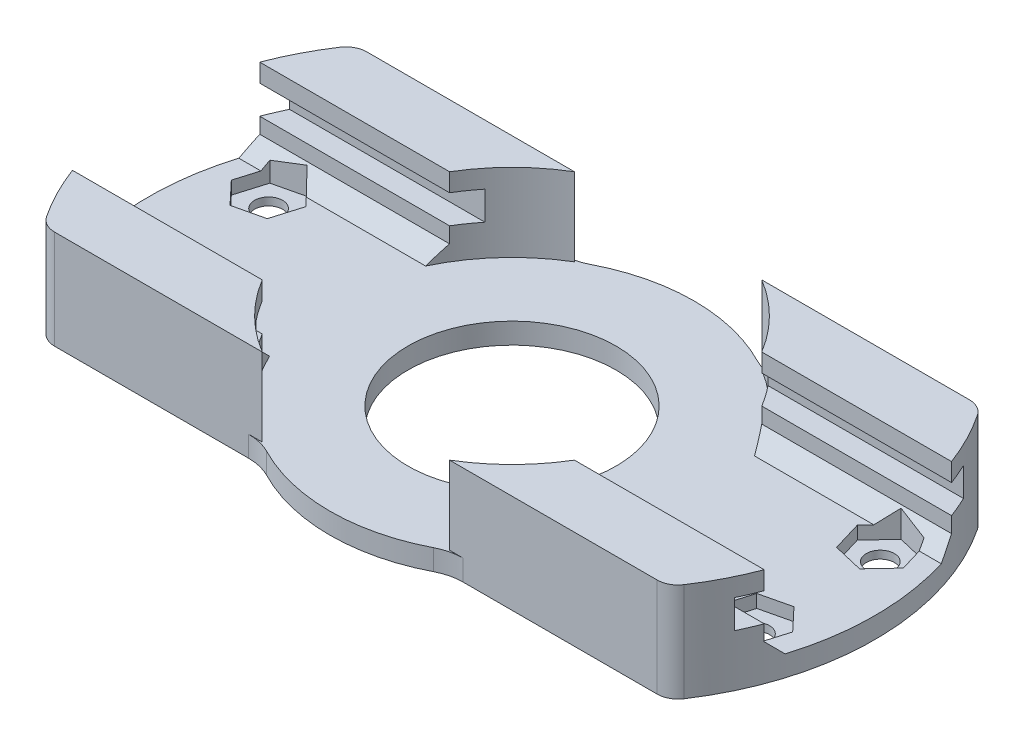
from build123d import *

# Parameters (mm, degrees)
EXTRUDE_1_DEPTH     = 2
EXTRUDE_START       = 2
EXTRUDE_2_DEPTH     = 3
EXTRUDE_START_2     = 5
EXTRUDE_3_DEPTH     = 2.75
EXTRUDE_START_3     = 7.75
EXTRUDE_4_DEPTH     = 1.75
SKETCH_3_R          = 10
CUT_EXTRUDE_2_DEPTH = 73.107267336
SKETCH_7_R          = 17.5
SKETCH_7_R_2        = 10
EXTRUDE_5_DEPTH     = 2
SKETCH_8_R          = 1.35
CUT_EXTRUDE_3_DEPTH = 74.182702893
CUT_EXTRUDE_4_DEPTH = 1.25
CHAMFER_1_SIZE      = 1.5
FILLET_10_R         = 2
FILLET_11_R         = 5


with BuildPart() as part:
    # Эскиз1 → Бобышка-Вытянуть1 (new body)
    with BuildSketch(Plane(origin=(0, 0, 0), x_dir=(1, 0, 0), z_dir=(0, 1, 0))):
        with BuildLine():
            Line((0, 0), (60, 0))
            ThreePointArc((60, 0), (64.878409373, 15), (60, 30))
            Line((60, 30), (0, 30))
            ThreePointArc((0, 30), (-4.878409373, 15), (0, 0))
        make_face()
    extrude(amount=EXTRUDE_1_DEPTH)

    # Эскиз1<3> → Бобышка-Вытянуть2 (add)
    with BuildSketch(Plane(origin=(0, 0, 0), x_dir=(1, 0, 0), z_dir=(0, 1, 0)).offset(EXTRUDE_START)):
        with BuildLine():
            ThreePointArc((0, 30), (-1.283416164, 28.054527087), (-2.383843513, 26))
            Line((-2.383843513, 26), (15, 26))
            Line((15, 26), (15, 30))
            Line((15, 30), (0, 30))
        make_face()
        with BuildLine():
            Line((15, 26), (-2.383843513, 26))
            ThreePointArc((-2.383843513, 26), (-2.831935188, 25.0091022), (-3.237369954, 24))
            Line((-3.237369954, 24), (15, 24))
            Line((15, 24), (15, 26))
        make_face()
        with BuildLine():
            Line((15, 4), (-2.383843513, 4))
            ThreePointArc((-2.383843513, 4), (-1.283416164, 1.945472913), (0, 0))
            Line((0, 0), (15, 0))
            Line((15, 0), (15, 4))
        make_face()
        with BuildLine():
            Line((15, 6), (-3.237369954, 6))
            ThreePointArc((-3.237369954, 6), (-2.831935188, 4.9908978), (-2.383843513, 4))
            Line((-2.383843513, 4), (15, 4))
            Line((15, 4), (15, 6))
        make_face()
        with BuildLine():
            Line((45, 30), (45, 26))
            Line((45, 26), (62.383843513, 26))
            ThreePointArc((62.383843513, 26), (61.283416164, 28.054527087), (60, 30))
            Line((60, 30), (45, 30))
        make_face()
        with BuildLine():
            Line((45, 26), (45, 24))
            Line((45, 24), (63.237369954, 24))
            ThreePointArc((63.237369954, 24), (62.831935188, 25.0091022), (62.383843513, 26))
            Line((62.383843513, 26), (45, 26))
        make_face()
        with BuildLine():
            Line((63.237369954, 6), (45, 6))
            Line((45, 6), (45, 4))
            Line((45, 4), (62.383843513, 4))
            ThreePointArc((62.383843513, 4), (62.831935188, 4.9908978), (63.237369954, 6))
        make_face()
        with BuildLine():
            Line((62.383843513, 4), (45, 4))
            Line((45, 4), (45, 0))
            Line((45, 0), (60, 0))
            ThreePointArc((60, 0), (61.283416164, 1.945472913), (62.383843513, 4))
        make_face()
        with BuildLine():
            Line((45, 0), (45, 4))
            Line((45, 4), (43.601470509, 4))
            ThreePointArc((43.601470509, 4), (41.476350347, 1.797978082), (39, 0))
            Line((39, 0), (45, 0))
        make_face()
        with BuildLine():
            Line((45, 4), (45, 6))
            ThreePointArc((45, 6), (44.335655856, 4.975581255), (43.601470509, 4))
            Line((43.601470509, 4), (45, 4))
        make_face()
        with BuildLine():
            Line((45, 26), (43.601470509, 26))
            ThreePointArc((43.601470509, 26), (44.335655856, 25.024418745), (45, 24))
            Line((45, 24), (45, 26))
        make_face()
        with BuildLine():
            ThreePointArc((39, 30), (41.476350347, 28.202021918), (43.601470509, 26))
            Line((43.601470509, 26), (45, 26))
            Line((45, 26), (45, 30))
            Line((45, 30), (39, 30))
        make_face()
        with BuildLine():
            Line((16.398529491, 26), (15, 26))
            Line((15, 26), (15, 24))
            ThreePointArc((15, 24), (15.664344144, 25.024418745), (16.398529491, 26))
        make_face()
        with BuildLine():
            Line((15, 30), (15, 26))
            Line((15, 26), (16.398529491, 26))
            ThreePointArc((16.398529491, 26), (18.523649653, 28.202021918), (21, 30))
            Line((21, 30), (15, 30))
        make_face()
        with BuildLine():
            Line((16.398529491, 4), (15, 4))
            Line((15, 4), (15, 0))
            Line((15, 0), (21, 0))
            ThreePointArc((21, 0), (18.523649653, 1.797978082), (16.398529491, 4))
        make_face()
        with BuildLine():
            ThreePointArc((16.398529491, 4), (15.664344144, 4.975581255), (15, 6))
            Line((15, 6), (15, 4))
            Line((15, 4), (16.398529491, 4))
        make_face()
    extrude(amount=EXTRUDE_2_DEPTH)

    # Эскиз1<4> → Бобышка-Вытянуть3 (add)
    with BuildSketch(Plane(origin=(0, 0, 0), x_dir=(1, 0, 0), z_dir=(0, 1, 0)).offset(EXTRUDE_START_2)):
        with BuildLine():
            Line((45, 30), (45, 26))
            Line((45, 26), (62.383843513, 26))
            ThreePointArc((62.383843513, 26), (61.283416164, 28.054527087), (60, 30))
            Line((60, 30), (45, 30))
        make_face()
        with BuildLine():
            Line((62.383843513, 4), (45, 4))
            Line((45, 4), (45, 0))
            Line((45, 0), (60, 0))
            ThreePointArc((60, 0), (61.283416164, 1.945472913), (62.383843513, 4))
        make_face()
        with BuildLine():
            Line((15, 4), (-2.383843513, 4))
            ThreePointArc((-2.383843513, 4), (-1.283416164, 1.945472913), (0, 0))
            Line((0, 0), (15, 0))
            Line((15, 0), (15, 4))
        make_face()
        with BuildLine():
            ThreePointArc((0, 30), (-1.283416164, 28.054527087), (-2.383843513, 26))
            Line((-2.383843513, 26), (15, 26))
            Line((15, 26), (15, 30))
            Line((15, 30), (0, 30))
        make_face()
        with BuildLine():
            Line((45, 0), (45, 4))
            Line((45, 4), (43.601470509, 4))
            ThreePointArc((43.601470509, 4), (41.476350347, 1.797978082), (39, 0))
            Line((39, 0), (45, 0))
        make_face()
        with BuildLine():
            Line((16.398529491, 4), (15, 4))
            Line((15, 4), (15, 0))
            Line((15, 0), (21, 0))
            ThreePointArc((21, 0), (18.523649653, 1.797978082), (16.398529491, 4))
        make_face()
        with BuildLine():
            Line((15, 30), (15, 26))
            Line((15, 26), (16.398529491, 26))
            ThreePointArc((16.398529491, 26), (18.523649653, 28.202021918), (21, 30))
            Line((21, 30), (15, 30))
        make_face()
        with BuildLine():
            ThreePointArc((39, 30), (41.476350347, 28.202021918), (43.601470509, 26))
            Line((43.601470509, 26), (45, 26))
            Line((45, 26), (45, 30))
            Line((45, 30), (39, 30))
        make_face()
    extrude(amount=EXTRUDE_3_DEPTH)

    # Эскиз1<5> → Бобышка-Вытянуть4 (add)
    with BuildSketch(Plane(origin=(0, 0, 0), x_dir=(1, 0, 0), z_dir=(0, 1, 0)).offset(EXTRUDE_START_3)):
        with BuildLine():
            ThreePointArc((0, 30), (-1.283416164, 28.054527087), (-2.383843513, 26))
            Line((-2.383843513, 26), (15, 26))
            Line((15, 26), (15, 30))
            Line((15, 30), (0, 30))
        make_face()
        with BuildLine():
            Line((15, 26), (-2.383843513, 26))
            ThreePointArc((-2.383843513, 26), (-2.831935188, 25.0091022), (-3.237369954, 24))
            Line((-3.237369954, 24), (15, 24))
            Line((15, 24), (15, 26))
        make_face()
        with BuildLine():
            Line((15, 6), (-3.237369954, 6))
            ThreePointArc((-3.237369954, 6), (-2.831935188, 4.9908978), (-2.383843513, 4))
            Line((-2.383843513, 4), (15, 4))
            Line((15, 4), (15, 6))
        make_face()
        with BuildLine():
            Line((15, 4), (-2.383843513, 4))
            ThreePointArc((-2.383843513, 4), (-1.283416164, 1.945472913), (0, 0))
            Line((0, 0), (15, 0))
            Line((15, 0), (15, 4))
        make_face()
        with BuildLine():
            Line((62.383843513, 4), (45, 4))
            Line((45, 4), (45, 0))
            Line((45, 0), (60, 0))
            ThreePointArc((60, 0), (61.283416164, 1.945472913), (62.383843513, 4))
        make_face()
        with BuildLine():
            Line((63.237369954, 6), (45, 6))
            Line((45, 6), (45, 4))
            Line((45, 4), (62.383843513, 4))
            ThreePointArc((62.383843513, 4), (62.831935188, 4.9908978), (63.237369954, 6))
        make_face()
        with BuildLine():
            Line((45, 30), (45, 26))
            Line((45, 26), (62.383843513, 26))
            ThreePointArc((62.383843513, 26), (61.283416164, 28.054527087), (60, 30))
            Line((60, 30), (45, 30))
        make_face()
        with BuildLine():
            Line((45, 26), (45, 24))
            Line((45, 24), (63.237369954, 24))
            ThreePointArc((63.237369954, 24), (62.831935188, 25.0091022), (62.383843513, 26))
            Line((62.383843513, 26), (45, 26))
        make_face()
        with BuildLine():
            Line((45, 26), (43.601470509, 26))
            ThreePointArc((43.601470509, 26), (44.335655856, 25.024418745), (45, 24))
            Line((45, 24), (45, 26))
        make_face()
        with BuildLine():
            ThreePointArc((39, 30), (41.476350347, 28.202021918), (43.601470509, 26))
            Line((43.601470509, 26), (45, 26))
            Line((45, 26), (45, 30))
            Line((45, 30), (39, 30))
        make_face()
        with BuildLine():
            Line((45, 0), (45, 4))
            Line((45, 4), (43.601470509, 4))
            ThreePointArc((43.601470509, 4), (41.476350347, 1.797978082), (39, 0))
            Line((39, 0), (45, 0))
        make_face()
        with BuildLine():
            Line((45, 4), (45, 6))
            ThreePointArc((45, 6), (44.335655856, 4.975581255), (43.601470509, 4))
            Line((43.601470509, 4), (45, 4))
        make_face()
        with BuildLine():
            Line((16.398529491, 4), (15, 4))
            Line((15, 4), (15, 0))
            Line((15, 0), (21, 0))
            ThreePointArc((21, 0), (18.523649653, 1.797978082), (16.398529491, 4))
        make_face()
        with BuildLine():
            ThreePointArc((16.398529491, 4), (15.664344144, 4.975581255), (15, 6))
            Line((15, 6), (15, 4))
            Line((15, 4), (16.398529491, 4))
        make_face()
        with BuildLine():
            Line((15, 30), (15, 26))
            Line((15, 26), (16.398529491, 26))
            ThreePointArc((16.398529491, 26), (18.523649653, 28.202021918), (21, 30))
            Line((21, 30), (15, 30))
        make_face()
        with BuildLine():
            Line((16.398529491, 26), (15, 26))
            Line((15, 26), (15, 24))
            ThreePointArc((15, 24), (15.664344144, 25.024418745), (16.398529491, 26))
        make_face()
    extrude(amount=EXTRUDE_4_DEPTH)

    # Эскиз3 → Вырез-Вытянуть2 (cut, through all)
    with BuildSketch(Plane(origin=(0, 0, 0), x_dir=(1, 0, 0), z_dir=(0, 1, 0))):
        with Locations(Location((30, 15, 0), (0, 0, 90))):
            Circle(SKETCH_3_R)
    extrude(amount=CUT_EXTRUDE_2_DEPTH, mode=Mode.SUBTRACT)

    # Эскиз7 → Бобышка-Вытянуть5 (add, through all)
    with BuildSketch(Plane(origin=(0, 2, 0), x_dir=(1, 0, 0), z_dir=(0, 1, 0))):
        with Locations((30, 15)):
            Circle(SKETCH_7_R)
        with Locations(Location((30, 15, 0), (0, 0, 90))):
            Circle(SKETCH_7_R_2, mode=Mode.SUBTRACT)
    extrude(amount=-EXTRUDE_5_DEPTH)

    # Эскиз8 → Вырез-Вытянуть3 (cut, through all)
    with BuildSketch(Plane.XZ):
        with Locations(Location((59.393876913, -21, 0), (0, 0, 270))):
            Circle(SKETCH_8_R)
        with Locations(Location((59.393876913, -9, 0), (0, 0, 270))):
            Circle(SKETCH_8_R)
        with Locations(Location((0.606123087, -9, 0), (0, 0, 270))):
            Circle(SKETCH_8_R)
        with Locations(Location((0.606123087, -21, 0), (0, 0, 270))):
            Circle(SKETCH_8_R)
    extrude(amount=-CUT_EXTRUDE_3_DEPTH, mode=Mode.SUBTRACT)

    # Эскиз9 → Вырез-Вытянуть4 (cut)
    with BuildSketch(Plane(origin=(0, 2, 0), x_dir=(1, 0, 0), z_dir=(0, 1, 0))):
        Polygon((60.247658071, 18.151861824), (62.287327506, 20.315327084), (61.433546348, 23.16346526), (58.540095755, 23.848138176), (56.500426321, 21.684672916), (57.354207479, 18.83653474), align=None)
        Polygon((62.287327506, 9.684672916), (60.247658071, 11.848138176), (57.354207479, 11.16346526), (56.500426321, 8.315327084), (58.540095755, 6.151861824), (61.433546348, 6.83653474), align=None)
        Polygon((-1.433546348, 6.83653474), (-2.287327506, 9.684672916), (-0.247658071, 11.848138176), (2.645792521, 11.16346526), (3.499573679, 8.315327084), (1.459904245, 6.151861824), align=None)
        Polygon((2.645792521, 18.83653474), (-0.247658071, 18.151861824), (-2.287327506, 20.315327084), (-1.433546348, 23.16346526), (1.459904245, 23.848138176), (3.499573679, 21.684672916), align=None)
    extrude(amount=-CUT_EXTRUDE_4_DEPTH, mode=Mode.SUBTRACT)

    # Фаска1
    # the kernel refuses this chamfer: 1.5 mm, written as the material it adds along each edge
    with BuildSketch(Plane(origin=(-7.094894436, 2, -6), x_dir=(0, -0.02749587661058635, -0.9996219169112968), z_dir=(1, 0, 0))) as chamfer_1_piece_1_section:
        Polygon((CHAMFER_1_SIZE * 0.999621916911, CHAMFER_1_SIZE * 0.0274958766106), (-CHAMFER_1_SIZE * 0.0274958766106, CHAMFER_1_SIZE * 0.999621916911), (0, 0), align=None)
    chamfer_1_piece_1 = extrude(amount=25.952418917, mode=Mode.PRIVATE)
    chamfer_1_piece_1 = chamfer_1_piece_1 & Plane(origin=(20.621590627, 2.530284666, -15), x_dir=(-0.8086898285216186, 0, -0.5882352941176473), z_dir=(0, -1, 0)) * Cylinder(25.5, 58, mode=Mode.PRIVATE)
    chamfer_1_piece_1 = split(chamfer_1_piece_1, bisect_by=Plane(origin=(-2.246079568, 2.530284666, -7.028803269), z_dir=(-0.23026956828607215, 0, 0.9731268806899468)), keep=Keep.TOP, mode=Mode.PRIVATE)
    chamfer_1_piece_1 = split(chamfer_1_piece_1, bisect_by=Plane(origin=(-1.399537025, 2.530284666, -6.723082655), z_dir=(-0.957887383926045, 0, 0.2871441444907378)), keep=Keep.TOP, mode=Mode.PRIVATE)
    add(chamfer_1_piece_1)
    with BuildSketch(Plane(origin=(-7.094894436, 2, -6), x_dir=(0, -0.02749587661058635, -0.9996219169112968), z_dir=(1, 0, 0))) as chamfer_1_piece_2_section:
        Polygon((CHAMFER_1_SIZE * 0.999621916911, CHAMFER_1_SIZE * 0.0274958766106), (-CHAMFER_1_SIZE * 0.0274958766106, CHAMFER_1_SIZE * 0.999621916911), (0, 0), align=None)
    chamfer_1_piece_2 = extrude(amount=25.952418917, mode=Mode.PRIVATE)
    chamfer_1_piece_2 = split(chamfer_1_piece_2, bisect_by=Plane(origin=(-0.106432043, 2.630794777, -6.522501653), z_dir=(-0.23026956828607215, 0, 0.9731268806899468)), keep=Keep.TOP, mode=Mode.PRIVATE)
    chamfer_1_piece_2 = split(chamfer_1_piece_2, bisect_by=Plane(origin=(0.732988005, 2.630794777, -5.380826084), z_dir=(-0.727617815639957, 0, -0.6859827361991975)), keep=Keep.TOP, mode=Mode.PRIVATE)
    chamfer_1_piece_2 = split(chamfer_1_piece_2, bisect_by=Plane(origin=(-1.164561987, 2.630794777, -5.939226782), z_dir=(0.957887383926045, 0, -0.2871441444907378)), keep=Keep.TOP, mode=Mode.PRIVATE)
    add(chamfer_1_piece_2)
    with BuildSketch(Plane(origin=(-7.094894436, 2, -6), x_dir=(0, -0.02749587661058635, -0.9996219169112968), z_dir=(1, 0, 0))) as chamfer_1_piece_3_section:
        Polygon((CHAMFER_1_SIZE * 0.999621916911, CHAMFER_1_SIZE * 0.0274958766106), (-CHAMFER_1_SIZE * 0.0274958766106, CHAMFER_1_SIZE * 0.999621916911), (0, 0), align=None)
    chamfer_1_piece_3 = extrude(amount=25.952418917, mode=Mode.PRIVATE)
    chamfer_1_piece_3 = chamfer_1_piece_3 & Plane(origin=(20.621590627, 2.12648314, -15), x_dir=(-0.8086898285216186, 0, -0.5882352941176473), z_dir=(0, -1, 0)) * Cylinder(25.5, 58, mode=Mode.PRIVATE)
    chamfer_1_piece_3 = split(chamfer_1_piece_3, bisect_by=Plane(origin=(-2.27034461, 2.12648314, -7.03454507), z_dir=(0.23026956828607215, 0, -0.9731268806899468)), keep=Keep.TOP, mode=Mode.PRIVATE)
    chamfer_1_piece_3 = split(chamfer_1_piece_3, bisect_by=Plane(origin=(-1.598747394, 2.12648314, -7.38763077), z_dir=(-0.957887383926045, 0, 0.2871441444907378)), keep=Keep.TOP, mode=Mode.PRIVATE)
    add(chamfer_1_piece_3)
    with BuildSketch(Plane(origin=(-7.094894436, 2, -6), x_dir=(0, -0.02749587661058635, -0.9996219169112968), z_dir=(1, 0, 0))) as chamfer_1_piece_4_section:
        Polygon((CHAMFER_1_SIZE * 0.999621916911, CHAMFER_1_SIZE * 0.0274958766106), (-CHAMFER_1_SIZE * 0.0274958766106, CHAMFER_1_SIZE * 0.999621916911), (0, 0), align=None)
    chamfer_1_piece_4 = extrude(amount=25.952418917, mode=Mode.PRIVATE)
    chamfer_1_piece_4 = split(chamfer_1_piece_4, bisect_by=Plane(origin=(1.688455007, 2.787416092, -6.097780197), z_dir=(-0.23026956828607215, 0, 0.9731268806899468)), keep=Keep.TOP, mode=Mode.PRIVATE)
    chamfer_1_piece_4 = split(chamfer_1_piece_4, bisect_by=Plane(origin=(1.495031284, 2.787416092, -6.189120867), z_dir=(0.727617815639957, 0, 0.6859827361991975)), keep=Keep.TOP, mode=Mode.PRIVATE)
    add(chamfer_1_piece_4)
    with BuildSketch(Plane(origin=(-7.094894436, 2, -6), x_dir=(0, -0.02749587661058635, -0.9996219169112968), z_dir=(1, 0, 0))) as chamfer_1_piece_5_section:
        Polygon((CHAMFER_1_SIZE * 0.999621916911, CHAMFER_1_SIZE * 0.0274958766106), (-CHAMFER_1_SIZE * 0.0274958766106, CHAMFER_1_SIZE * 0.999621916911), (0, 0), align=None)
    chamfer_1_piece_5 = extrude(amount=25.952418917, mode=Mode.PRIVATE)
    chamfer_1_piece_5 = chamfer_1_piece_5 - Plane(origin=(30, 2.501012704, -15), x_dir=(-0.5144957554275518, 0, 0.857492925712529), z_dir=(0, -1, 0)) * Cylinder(17.492855685, 58, mode=Mode.PRIVATE)
    chamfer_1_piece_5 = split(chamfer_1_piece_5, bisect_by=Plane(origin=(7.868862085, 2.501012704, -4.63531965), z_dir=(0.23026956828607215, 0, -0.9731268806899468)), keep=Keep.TOP, mode=Mode.PRIVATE)
    chamfer_1_piece_5 = split(chamfer_1_piece_5, bisect_by=Plane(origin=(4.846321169, 2.501012704, -9.743814151), z_dir=(0.727617815639957, 0, 0.6859827361991975)), keep=Keep.TOP, mode=Mode.PRIVATE)
    add(chamfer_1_piece_5)
    with BuildSketch(Plane(origin=(41.142475518, 2, -6), x_dir=(0, -0.02749587661058635, -0.9996219169112968), z_dir=(1, 0, 0))) as chamfer_1_piece_6_section:
        Polygon((CHAMFER_1_SIZE * 0.999621916911, CHAMFER_1_SIZE * 0.0274958766106), (-CHAMFER_1_SIZE * 0.0274958766106, CHAMFER_1_SIZE * 0.999621916911), (0, 0), align=None)
    chamfer_1_piece_6 = extrude(amount=25.952418917, mode=Mode.PRIVATE)
    chamfer_1_piece_6 = chamfer_1_piece_6 - Plane(origin=(30, 2.501012704, -15), x_dir=(0.8574929257125434, 0, 0.5144957554275279), z_dir=(0, -1, 0)) * Cylinder(17.492855685, 58, mode=Mode.PRIVATE)
    chamfer_1_piece_6 = split(chamfer_1_piece_6, bisect_by=Plane(origin=(55.153678831, 2.501012704, -9.743814151), z_dir=(-0.7276178156399574, 0, 0.685982736199197)), keep=Keep.TOP, mode=Mode.PRIVATE)
    chamfer_1_piece_6 = split(chamfer_1_piece_6, bisect_by=Plane(origin=(52.131137915, 2.501012704, -4.63531965), z_dir=(-0.23026956828607253, 0, -0.9731268806899468)), keep=Keep.TOP, mode=Mode.PRIVATE)
    add(chamfer_1_piece_6)
    with BuildSketch(Plane(origin=(41.142475518, 2, -6), x_dir=(0, -0.02749587661058635, -0.9996219169112968), z_dir=(1, 0, 0))) as chamfer_1_piece_7_section:
        Polygon((CHAMFER_1_SIZE * 0.999621916911, CHAMFER_1_SIZE * 0.0274958766106), (-CHAMFER_1_SIZE * 0.0274958766106, CHAMFER_1_SIZE * 0.999621916911), (0, 0), align=None)
    chamfer_1_piece_7 = extrude(amount=25.952418917, mode=Mode.PRIVATE)
    chamfer_1_piece_7 = split(chamfer_1_piece_7, bisect_by=Plane(origin=(58.504968716, 2.787416092, -6.189120867), z_dir=(-0.7276178156399574, 0, 0.685982736199197)), keep=Keep.TOP, mode=Mode.PRIVATE)
    chamfer_1_piece_7 = split(chamfer_1_piece_7, bisect_by=Plane(origin=(58.311544993, 2.787416092, -6.097780197), z_dir=(0.23026956828607253, 0, 0.9731268806899468)), keep=Keep.TOP, mode=Mode.PRIVATE)
    add(chamfer_1_piece_7)
    with BuildSketch(Plane(origin=(41.142475518, 2, -6), x_dir=(0, -0.02749587661058635, -0.9996219169112968), z_dir=(1, 0, 0))) as chamfer_1_piece_8_section:
        Polygon((CHAMFER_1_SIZE * 0.999621916911, CHAMFER_1_SIZE * 0.0274958766106), (-CHAMFER_1_SIZE * 0.0274958766106, CHAMFER_1_SIZE * 0.999621916911), (0, 0), align=None)
    chamfer_1_piece_8 = extrude(amount=25.952418917, mode=Mode.PRIVATE)
    chamfer_1_piece_8 = split(chamfer_1_piece_8, bisect_by=Plane(origin=(59.267011995, 2.630794777, -5.380826084), z_dir=(0.7276178156399574, 0, -0.685982736199197)), keep=Keep.TOP, mode=Mode.PRIVATE)
    chamfer_1_piece_8 = split(chamfer_1_piece_8, bisect_by=Plane(origin=(60.106432043, 2.630794777, -6.522501653), z_dir=(0.23026956828607253, 0, 0.9731268806899468)), keep=Keep.TOP, mode=Mode.PRIVATE)
    chamfer_1_piece_8 = split(chamfer_1_piece_8, bisect_by=Plane(origin=(61.164561987, 2.630794777, -5.939226782), z_dir=(-0.9578873839260451, 0, -0.2871441444907374)), keep=Keep.TOP, mode=Mode.PRIVATE)
    add(chamfer_1_piece_8)
    with BuildSketch(Plane(origin=(41.142475518, 2, -6), x_dir=(0, -0.02749587661058635, -0.9996219169112968), z_dir=(1, 0, 0))) as chamfer_1_piece_9_section:
        Polygon((CHAMFER_1_SIZE * 0.999621916911, CHAMFER_1_SIZE * 0.0274958766106), (-CHAMFER_1_SIZE * 0.0274958766106, CHAMFER_1_SIZE * 0.999621916911), (0, 0), align=None)
    chamfer_1_piece_9 = extrude(amount=25.952418917, mode=Mode.PRIVATE)
    chamfer_1_piece_9 = chamfer_1_piece_9 & Plane(origin=(39.378409373, 2.12648314, -15), x_dir=(0.8086898285216193, 0, 0.5882352941176464), z_dir=(0, -1, 0)) * Cylinder(25.5, 58, mode=Mode.PRIVATE)
    chamfer_1_piece_9 = split(chamfer_1_piece_9, bisect_by=Plane(origin=(62.270344613, 2.12648314, -7.034545071), z_dir=(-0.23026956828607253, 0, -0.9731268806899468)), keep=Keep.TOP, mode=Mode.PRIVATE)
    chamfer_1_piece_9 = split(chamfer_1_piece_9, bisect_by=Plane(origin=(61.598747395, 2.12648314, -7.387630771), z_dir=(0.9578873839260451, 0, 0.2871441444907374)), keep=Keep.TOP, mode=Mode.PRIVATE)
    add(chamfer_1_piece_9)
    with BuildSketch(Plane(origin=(41.142475518, 2, -6), x_dir=(0, -0.02749587661058635, -0.9996219169112968), z_dir=(1, 0, 0))) as chamfer_1_piece_10_section:
        Polygon((CHAMFER_1_SIZE * 0.999621916911, CHAMFER_1_SIZE * 0.0274958766106), (-CHAMFER_1_SIZE * 0.0274958766106, CHAMFER_1_SIZE * 0.999621916911), (0, 0), align=None)
    chamfer_1_piece_10 = extrude(amount=25.952418917, mode=Mode.PRIVATE)
    chamfer_1_piece_10 = chamfer_1_piece_10 & Plane(origin=(39.378409373, 2.530284668, -15), x_dir=(0.8086898285216193, 0, 0.5882352941176464), z_dir=(0, -1, 0)) * Cylinder(25.5, 58, mode=Mode.PRIVATE)
    chamfer_1_piece_10 = split(chamfer_1_piece_10, bisect_by=Plane(origin=(62.246079566, 2.530284668, -7.028803268), z_dir=(0.23026956828607253, 0, 0.9731268806899468)), keep=Keep.TOP, mode=Mode.PRIVATE)
    chamfer_1_piece_10 = split(chamfer_1_piece_10, bisect_by=Plane(origin=(61.399537024, 2.530284668, -6.723082654), z_dir=(0.9578873839260451, 0, 0.2871441444907374)), keep=Keep.TOP, mode=Mode.PRIVATE)
    add(chamfer_1_piece_10)
    with BuildSketch(Plane(origin=(67.094894436, 2, -24), x_dir=(0, -0.027495876610586334, 0.9996219169112968), z_dir=(-1, 0, 0))) as chamfer_1_piece_11_section:
        Polygon((CHAMFER_1_SIZE * 0.999621916911, CHAMFER_1_SIZE * 0.0274958766106), (-CHAMFER_1_SIZE * 0.0274958766106, CHAMFER_1_SIZE * 0.999621916911), (0, 0), align=None)
    chamfer_1_piece_11 = extrude(amount=25.952418917, mode=Mode.PRIVATE)
    chamfer_1_piece_11 = chamfer_1_piece_11 & Plane(origin=(39.378409373, 2.530284667, -15), x_dir=(0.8086898285216193, 0, 0.5882352941176464), z_dir=(0, -1, 0)) * Cylinder(25.5, 58, mode=Mode.PRIVATE)
    chamfer_1_piece_11 = split(chamfer_1_piece_11, bisect_by=Plane(origin=(61.399537024, 2.530284667, -23.276917346), z_dir=(0.9578873839260517, 0, -0.28714414449071574)), keep=Keep.TOP, mode=Mode.PRIVATE)
    chamfer_1_piece_11 = split(chamfer_1_piece_11, bisect_by=Plane(origin=(62.246079568, 2.530284667, -22.971196731), z_dir=(0.2302695682860868, 0, -0.9731268806899434)), keep=Keep.TOP, mode=Mode.PRIVATE)
    add(chamfer_1_piece_11)
    with BuildSketch(Plane(origin=(67.094894436, 2, -24), x_dir=(0, -0.027495876610586334, 0.9996219169112968), z_dir=(-1, 0, 0))) as chamfer_1_piece_12_section:
        Polygon((CHAMFER_1_SIZE * 0.999621916911, CHAMFER_1_SIZE * 0.0274958766106), (-CHAMFER_1_SIZE * 0.0274958766106, CHAMFER_1_SIZE * 0.999621916911), (0, 0), align=None)
    chamfer_1_piece_12 = extrude(amount=25.952418917, mode=Mode.PRIVATE)
    chamfer_1_piece_12 = split(chamfer_1_piece_12, bisect_by=Plane(origin=(61.164561987, 2.630794777, -24.060773218), z_dir=(-0.9578873839260517, 0, 0.28714414449071574)), keep=Keep.TOP, mode=Mode.PRIVATE)
    chamfer_1_piece_12 = split(chamfer_1_piece_12, bisect_by=Plane(origin=(60.106432043, 2.630794777, -23.477498347), z_dir=(0.2302695682860868, 0, -0.9731268806899434)), keep=Keep.TOP, mode=Mode.PRIVATE)
    chamfer_1_piece_12 = split(chamfer_1_piece_12, bisect_by=Plane(origin=(59.267011995, 2.630794777, -24.619173916), z_dir=(0.7276178156399332, 0, 0.6859827361992226)), keep=Keep.TOP, mode=Mode.PRIVATE)
    add(chamfer_1_piece_12)
    with BuildSketch(Plane(origin=(67.094894436, 2, -24), x_dir=(0, -0.027495876610586334, 0.9996219169112968), z_dir=(-1, 0, 0))) as chamfer_1_piece_13_section:
        Polygon((CHAMFER_1_SIZE * 0.999621916911, CHAMFER_1_SIZE * 0.0274958766106), (-CHAMFER_1_SIZE * 0.0274958766106, CHAMFER_1_SIZE * 0.999621916911), (0, 0), align=None)
    chamfer_1_piece_13 = extrude(amount=25.952418917, mode=Mode.PRIVATE)
    chamfer_1_piece_13 = chamfer_1_piece_13 & Plane(origin=(39.378409373, 2.126483141, -15), x_dir=(0.8086898285216193, 0, 0.5882352941176464), z_dir=(0, -1, 0)) * Cylinder(25.5, 58, mode=Mode.PRIVATE)
    chamfer_1_piece_13 = split(chamfer_1_piece_13, bisect_by=Plane(origin=(61.598747394, 2.126483141, -22.612369231), z_dir=(0.9578873839260517, 0, -0.28714414449071574)), keep=Keep.TOP, mode=Mode.PRIVATE)
    chamfer_1_piece_13 = split(chamfer_1_piece_13, bisect_by=Plane(origin=(62.270344608, 2.126483141, -22.965454931), z_dir=(-0.2302695682860868, 0, 0.9731268806899434)), keep=Keep.TOP, mode=Mode.PRIVATE)
    add(chamfer_1_piece_13)
    with BuildSketch(Plane(origin=(67.094894436, 2, -24), x_dir=(0, -0.027495876610586334, 0.9996219169112968), z_dir=(-1, 0, 0))) as chamfer_1_piece_14_section:
        Polygon((CHAMFER_1_SIZE * 0.999621916911, CHAMFER_1_SIZE * 0.0274958766106), (-CHAMFER_1_SIZE * 0.0274958766106, CHAMFER_1_SIZE * 0.999621916911), (0, 0), align=None)
    chamfer_1_piece_14 = extrude(amount=25.952418917, mode=Mode.PRIVATE)
    chamfer_1_piece_14 = split(chamfer_1_piece_14, bisect_by=Plane(origin=(58.311544993, 2.787416092, -23.902219803), z_dir=(0.2302695682860868, 0, -0.9731268806899434)), keep=Keep.TOP, mode=Mode.PRIVATE)
    chamfer_1_piece_14 = split(chamfer_1_piece_14, bisect_by=Plane(origin=(58.504968716, 2.787416092, -23.810879133), z_dir=(-0.7276178156399332, 0, -0.6859827361992226)), keep=Keep.TOP, mode=Mode.PRIVATE)
    add(chamfer_1_piece_14)
    with BuildSketch(Plane(origin=(67.094894436, 2, -24), x_dir=(0, -0.027495876610586334, 0.9996219169112968), z_dir=(-1, 0, 0))) as chamfer_1_piece_15_section:
        Polygon((CHAMFER_1_SIZE * 0.999621916911, CHAMFER_1_SIZE * 0.0274958766106), (-CHAMFER_1_SIZE * 0.0274958766106, CHAMFER_1_SIZE * 0.999621916911), (0, 0), align=None)
    chamfer_1_piece_15 = extrude(amount=25.952418917, mode=Mode.PRIVATE)
    chamfer_1_piece_15 = chamfer_1_piece_15 - Plane(origin=(30, 2.501012704, -15), x_dir=(0.7775443160352454, 0, -0.6288281455225126), z_dir=(0, -1, 0)) * Cylinder(17.492855685, 58, mode=Mode.PRIVATE)
    chamfer_1_piece_15 = split(chamfer_1_piece_15, bisect_by=Plane(origin=(52.131137915, 2.501012704, -25.36468035), z_dir=(-0.2302695682860868, 0, 0.9731268806899434)), keep=Keep.TOP, mode=Mode.PRIVATE)
    chamfer_1_piece_15 = split(chamfer_1_piece_15, bisect_by=Plane(origin=(55.153678831, 2.501012704, -20.256185849), z_dir=(-0.7276178156399332, 0, -0.6859827361992226)), keep=Keep.TOP, mode=Mode.PRIVATE)
    add(chamfer_1_piece_15)
    with BuildSketch(Plane(origin=(18.857524482, 2, -24), x_dir=(0, -0.027495876610586334, 0.9996219169112968), z_dir=(-1, 0, 0))) as chamfer_1_piece_16_section:
        Polygon((CHAMFER_1_SIZE * 0.999621916911, CHAMFER_1_SIZE * 0.0274958766106), (-CHAMFER_1_SIZE * 0.0274958766106, CHAMFER_1_SIZE * 0.999621916911), (0, 0), align=None)
    chamfer_1_piece_16 = extrude(amount=25.952418917, mode=Mode.PRIVATE)
    chamfer_1_piece_16 = chamfer_1_piece_16 - Plane(origin=(30, 2.501012704, -15), x_dir=(-0.8574929257125472, 0, -0.5144957554275216), z_dir=(0, -1, 0)) * Cylinder(17.492855685, 58, mode=Mode.PRIVATE)
    chamfer_1_piece_16 = split(chamfer_1_piece_16, bisect_by=Plane(origin=(4.846321169, 2.501012704, -20.256185849), z_dir=(0.7276178156399331, 0, -0.6859827361992227)), keep=Keep.TOP, mode=Mode.PRIVATE)
    chamfer_1_piece_16 = split(chamfer_1_piece_16, bisect_by=Plane(origin=(7.868862085, 2.501012704, -25.36468035), z_dir=(0.23026956828608677, 0, 0.9731268806899434)), keep=Keep.TOP, mode=Mode.PRIVATE)
    add(chamfer_1_piece_16)
    with BuildSketch(Plane(origin=(18.857524482, 2, -24), x_dir=(0, -0.027495876610586334, 0.9996219169112968), z_dir=(-1, 0, 0))) as chamfer_1_piece_17_section:
        Polygon((CHAMFER_1_SIZE * 0.999621916911, CHAMFER_1_SIZE * 0.0274958766106), (-CHAMFER_1_SIZE * 0.0274958766106, CHAMFER_1_SIZE * 0.999621916911), (0, 0), align=None)
    chamfer_1_piece_17 = extrude(amount=25.952418917, mode=Mode.PRIVATE)
    chamfer_1_piece_17 = split(chamfer_1_piece_17, bisect_by=Plane(origin=(1.495031284, 2.787416092, -23.810879133), z_dir=(0.7276178156399331, 0, -0.6859827361992227)), keep=Keep.TOP, mode=Mode.PRIVATE)
    chamfer_1_piece_17 = split(chamfer_1_piece_17, bisect_by=Plane(origin=(1.688455007, 2.787416092, -23.902219803), z_dir=(-0.23026956828608677, 0, -0.9731268806899434)), keep=Keep.TOP, mode=Mode.PRIVATE)
    add(chamfer_1_piece_17)
    with BuildSketch(Plane(origin=(18.857524482, 2, -24), x_dir=(0, -0.027495876610586334, 0.9996219169112968), z_dir=(-1, 0, 0))) as chamfer_1_piece_18_section:
        Polygon((CHAMFER_1_SIZE * 0.999621916911, CHAMFER_1_SIZE * 0.0274958766106), (-CHAMFER_1_SIZE * 0.0274958766106, CHAMFER_1_SIZE * 0.999621916911), (0, 0), align=None)
    chamfer_1_piece_18 = extrude(amount=25.952418917, mode=Mode.PRIVATE)
    chamfer_1_piece_18 = split(chamfer_1_piece_18, bisect_by=Plane(origin=(0.732988005, 2.630794777, -24.619173916), z_dir=(-0.7276178156399331, 0, 0.6859827361992227)), keep=Keep.TOP, mode=Mode.PRIVATE)
    chamfer_1_piece_18 = split(chamfer_1_piece_18, bisect_by=Plane(origin=(-0.106432043, 2.630794777, -23.477498347), z_dir=(-0.23026956828608677, 0, -0.9731268806899434)), keep=Keep.TOP, mode=Mode.PRIVATE)
    chamfer_1_piece_18 = split(chamfer_1_piece_18, bisect_by=Plane(origin=(-1.164561987, 2.630794777, -24.060773218), z_dir=(0.9578873839260514, 0, 0.28714414449071646)), keep=Keep.TOP, mode=Mode.PRIVATE)
    add(chamfer_1_piece_18)
    with BuildSketch(Plane(origin=(18.857524482, 2, -24), x_dir=(0, -0.027495876610586334, 0.9996219169112968), z_dir=(-1, 0, 0))) as chamfer_1_piece_19_section:
        Polygon((CHAMFER_1_SIZE * 0.999621916911, CHAMFER_1_SIZE * 0.0274958766106), (-CHAMFER_1_SIZE * 0.0274958766106, CHAMFER_1_SIZE * 0.999621916911), (0, 0), align=None)
    chamfer_1_piece_19 = extrude(amount=25.952418917, mode=Mode.PRIVATE)
    chamfer_1_piece_19 = chamfer_1_piece_19 & Plane(origin=(20.621590627, 2.126483141, -15), x_dir=(-0.8086898285216186, 0, -0.5882352941176473), z_dir=(0, -1, 0)) * Cylinder(25.5, 58, mode=Mode.PRIVATE)
    chamfer_1_piece_19 = split(chamfer_1_piece_19, bisect_by=Plane(origin=(-2.270344611, 2.126483141, -22.96545493), z_dir=(0.23026956828608677, 0, 0.9731268806899434)), keep=Keep.TOP, mode=Mode.PRIVATE)
    chamfer_1_piece_19 = split(chamfer_1_piece_19, bisect_by=Plane(origin=(-1.598747395, 2.126483141, -22.612369229), z_dir=(-0.9578873839260514, 0, -0.28714414449071646)), keep=Keep.TOP, mode=Mode.PRIVATE)
    add(chamfer_1_piece_19)
    with BuildSketch(Plane(origin=(18.857524482, 2, -24), x_dir=(0, -0.027495876610586334, 0.9996219169112968), z_dir=(-1, 0, 0))) as chamfer_1_piece_20_section:
        Polygon((CHAMFER_1_SIZE * 0.999621916911, CHAMFER_1_SIZE * 0.0274958766106), (-CHAMFER_1_SIZE * 0.0274958766106, CHAMFER_1_SIZE * 0.999621916911), (0, 0), align=None)
    chamfer_1_piece_20 = extrude(amount=25.952418917, mode=Mode.PRIVATE)
    chamfer_1_piece_20 = chamfer_1_piece_20 & Plane(origin=(20.621590627, 2.530284669, -15), x_dir=(-0.8086898285216186, 0, -0.5882352941176473), z_dir=(0, -1, 0)) * Cylinder(25.5, 58, mode=Mode.PRIVATE)
    chamfer_1_piece_20 = split(chamfer_1_piece_20, bisect_by=Plane(origin=(-2.246079565, 2.530284669, -22.971196732), z_dir=(-0.23026956828608677, 0, -0.9731268806899434)), keep=Keep.TOP, mode=Mode.PRIVATE)
    chamfer_1_piece_20 = split(chamfer_1_piece_20, bisect_by=Plane(origin=(-1.399537024, 2.530284669, -23.276917347), z_dir=(-0.9578873839260514, 0, -0.28714414449071646)), keep=Keep.TOP, mode=Mode.PRIVATE)
    add(chamfer_1_piece_20)

    # Скругление10
    fillet_10_edges = [part.edges().sort_by_distance(p)[0] for p in [
        (0, 4.75, -30),
        (0, 4.75, 0),
        (60, 4.75, 0),
        (60, 4.75, -30),
    ]]
    fillet(fillet_10_edges, radius=FILLET_10_R)

    # Скругление11
    fillet_11_edges = [part.edges().sort_by_distance(p)[0] for p in [
        (20.986121811, 1, 0),
        (39.013878189, 1, 0),
        (20.986121811, 1, -30),
        (39.013878189, 1, -30),
    ]]
    fillet(fillet_11_edges, radius=FILLET_11_R)


solid = part.part
